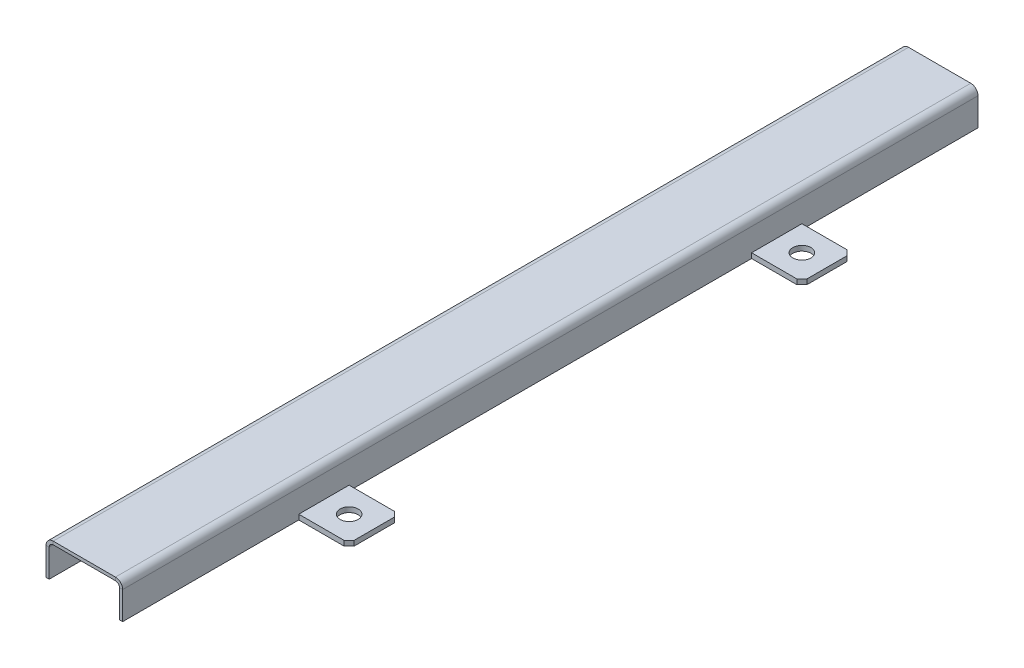
from build123d import *

# Parameters (mm, degrees)
BASE_FLANGE3_DEPTH       = 425
SKETCH21_W               = 50
SKETCH21_H               = 5
BOSS_EXTRUDE2_DEPTH      = 50
CHAMFER1_SIZE            = 5
SKETCH26_R               = 9
CUT_EXTRUDE1_DEPTH       = 50
CHAMFER1_OF_MIRROR1_SIZE = 5


# Sheet-metal steps are written as plain solids
with BuildPart() as part:
    # Sketch1 → Base-Flange3 (new, symmetric)
    with BuildSketch(Plane.XY):
        with BuildLine():
            Line((63.8, 0), (63.8, 27.625))
            ThreePointArc((63.8, 27.625), (65.901508845, 32.698491155), (70.975, 34.8))
            Line((70.975, 34.8), (132.825, 34.8))
            ThreePointArc((132.825, 34.8), (137.898491155, 32.698491155), (140, 27.625))
            Line((140, 27.625), (140, 0))
            Line((140, 0), (136.825, 0))
            Line((136.825, 0), (136.825, 27.625))
            ThreePointArc((136.825, 27.625), (135.653427125, 30.453427125), (132.825, 31.625))
            Line((132.825, 31.625), (70.975, 31.625))
            ThreePointArc((70.975, 31.625), (68.146572875, 30.453427125), (66.975, 27.625))
            Line((66.975, 27.625), (66.975, 0))
            Line((66.975, 0), (63.8, 0))
        make_face()
    extrude(amount=BASE_FLANGE3_DEPTH, both=True)

    # Sketch21 → Boss-Extrude2 (add)
    with BuildSketch(Plane(origin=(140, 0, 0), x_dir=(0, 0, -1), z_dir=(1, 0, 0))):
        with Locations((-225, 2.5)):
            Rectangle(SKETCH21_W, SKETCH21_H)
    boss_extrude2 = extrude(amount=BOSS_EXTRUDE2_DEPTH)

    # Chamfer1
    chamfer1_edges = [part.edges().sort_by_distance(p)[0] for p in [
        (190, 2.5, 250),
        (190, 2.5, 200),
    ]]
    chamfer(chamfer1_edges, length=CHAMFER1_SIZE)

    # Sketch26 → Cut-Extrude1 (cut)
    with BuildSketch(Plane(origin=(0, 5, 0), x_dir=(1, 0, 0), z_dir=(0, 1, 0))):
        with Locations(Location((165, -225, 0), (0, 0, 270))):
            Circle(SKETCH26_R)
    cut_extrude1 = extrude(amount=-CUT_EXTRUDE1_DEPTH, mode=Mode.SUBTRACT)

    # Mirror1: Boss-Extrude2, Cut-Extrude1 across plane
    add(boss_extrude2.mirror(Plane.XY))
    add(cut_extrude1.mirror(Plane.XY), mode=Mode.SUBTRACT)

    # Chamfer1 of Mirror1
    chamfer1_of_mirror1_edges = [part.edges().sort_by_distance(p)[0] for p in [
        (190, 2.5, -250),
        (190, 2.5, -200),
    ]]
    chamfer(chamfer1_of_mirror1_edges, length=CHAMFER1_OF_MIRROR1_SIZE)


solid = part.part
